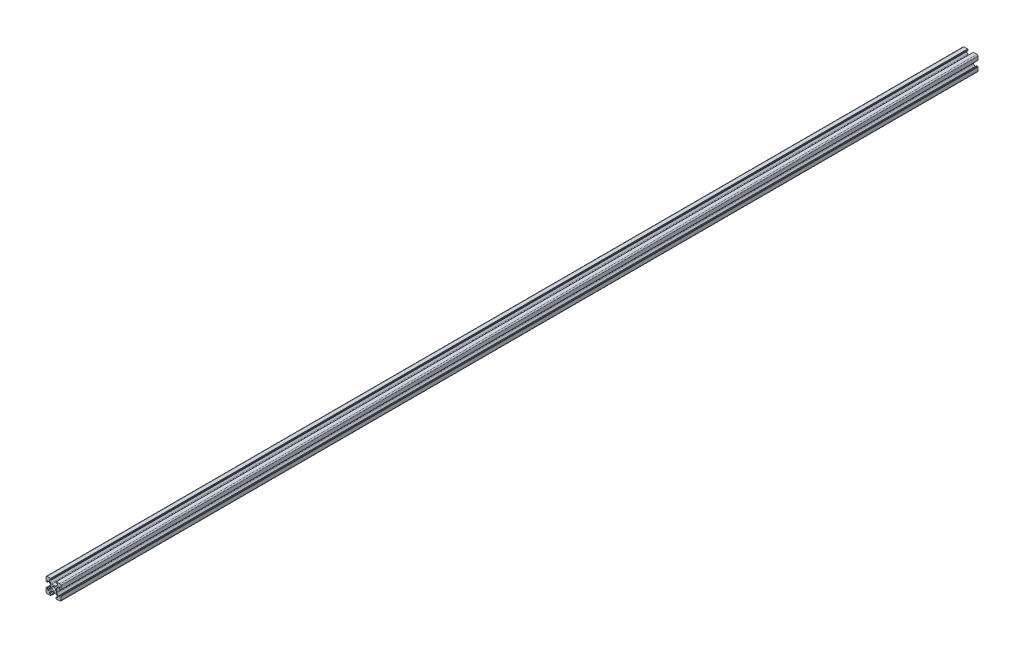
from build123d import *

# Parameters (mm, degrees)
SKETCH_1_R      = 2.5
EXTRUDE_1_DEPTH = 1220


with BuildPart() as part:
    # 草图1 → 凸台-拉伸1 (new body)
    with BuildSketch(Plane.XY):
        with BuildLine():
            ThreePointArc((-10.002261885, -8.502261885), (-9.562922057, -9.562922057), (-8.502261885, -10.002261885))
            Line((-8.502261885, -10.002261885), (-3.85, -10.002261885))
            ThreePointArc((-3.85, -10.002261885), (-3.673223305, -9.929038581), (-3.6, -9.752261885))
            Line((-3.6, -9.752261885), (-3.6, -9.502261885))
            Line((-3.6, -9.502261885), (-3.35, -9.502261885))
            ThreePointArc((-3.35, -9.502261885), (-3.173223305, -9.429038581), (-3.1, -9.252261885))
            Line((-3.1, -9.252261885), (-3.1, -8.45))
            ThreePointArc((-3.1, -8.45), (-3.173223305, -8.273223305), (-3.35, -8.2))
            Line((-3.35, -8.2), (-5.25, -8.2))
            ThreePointArc((-5.25, -8.2), (-5.426776695, -8.126776695), (-5.5, -7.95))
            Line((-5.5, -7.95), (-5.5, -6.664213562))
            ThreePointArc((-5.5, -6.664213562), (-5.480969883, -6.568542704), (-5.426776695, -6.487436867))
            Line((-5.426776695, -6.487436867), (-3.278679656, -4.339339828))
            ThreePointArc((-3.278679656, -4.339339828), (-2.792044633, -4.014180701), (-2.218019485, -3.9))
            Line((-2.218019485, -3.9), (2.218019485, -3.9))
            ThreePointArc((2.218019485, -3.9), (2.792044633, -4.014180701), (3.278679656, -4.339339828))
            Line((3.278679656, -4.339339828), (5.426776695, -6.487436867))
            ThreePointArc((5.426776695, -6.487436867), (5.480969883, -6.568542704), (5.5, -6.664213562))
            Line((5.5, -6.664213562), (5.5, -7.95))
            ThreePointArc((5.5, -7.95), (5.426776695, -8.126776695), (5.25, -8.2))
            Line((5.25, -8.2), (3.35, -8.2))
            ThreePointArc((3.35, -8.2), (3.173223305, -8.273223305), (3.1, -8.45))
            Line((3.1, -8.45), (3.1, -9.252261885))
            ThreePointArc((3.1, -9.252261885), (3.173223305, -9.429038581), (3.35, -9.502261885))
            Line((3.35, -9.502261885), (3.6, -9.502261885))
            Line((3.6, -9.502261885), (3.6, -9.752261885))
            ThreePointArc((3.6, -9.752261885), (3.673223305, -9.929038581), (3.85, -10.002261885))
            Line((3.85, -10.002261885), (8.502261885, -10.002261885))
            ThreePointArc((8.502261885, -10.002261885), (9.562922057, -9.562922057), (10.002261885, -8.502261885))
            Line((10.002261885, -8.502261885), (10.002261885, -3.85))
            ThreePointArc((10.002261885, -3.85), (9.929038581, -3.673223305), (9.752261885, -3.6))
            Line((9.752261885, -3.6), (9.502261885, -3.6))
            Line((9.502261885, -3.6), (9.502261885, -3.35))
            ThreePointArc((9.502261885, -3.35), (9.429038581, -3.173223305), (9.252261885, -3.1))
            Line((9.252261885, -3.1), (8.45, -3.1))
            ThreePointArc((8.45, -3.1), (8.273223305, -3.173223305), (8.2, -3.35))
            Line((8.2, -3.35), (8.2, -5.25))
            ThreePointArc((8.2, -5.25), (8.126776695, -5.426776695), (7.95, -5.5))
            Line((7.95, -5.5), (6.664213562, -5.5))
            ThreePointArc((6.664213562, -5.5), (6.568542704, -5.480969883), (6.487436867, -5.426776695))
            Line((6.487436867, -5.426776695), (4.339339828, -3.278679656))
            ThreePointArc((4.339339828, -3.278679656), (4.014180701, -2.792044633), (3.9, -2.218019485))
            Line((3.9, -2.218019485), (3.9, 2.218019485))
            ThreePointArc((3.9, 2.218019485), (4.014180701, 2.792044633), (4.339339828, 3.278679656))
            Line((4.339339828, 3.278679656), (6.487436867, 5.426776695))
            ThreePointArc((6.487436867, 5.426776695), (6.568542704, 5.480969883), (6.664213562, 5.5))
            Line((6.664213562, 5.5), (7.95, 5.5))
            ThreePointArc((7.95, 5.5), (8.126776695, 5.426776695), (8.2, 5.25))
            Line((8.2, 5.25), (8.2, 3.35))
            ThreePointArc((8.2, 3.35), (8.273223305, 3.173223305), (8.45, 3.1))
            Line((8.45, 3.1), (9.252261885, 3.1))
            ThreePointArc((9.252261885, 3.1), (9.429038581, 3.173223305), (9.502261885, 3.35))
            Line((9.502261885, 3.35), (9.502261885, 3.6))
            Line((9.502261885, 3.6), (9.752261885, 3.6))
            ThreePointArc((9.752261885, 3.6), (9.929038581, 3.673223305), (10.002261885, 3.85))
            Line((10.002261885, 3.85), (10.002261885, 8.502261885))
            ThreePointArc((10.002261885, 8.502261885), (9.562922057, 9.562922057), (8.502261885, 10.002261885))
            Line((8.502261885, 10.002261885), (3.85, 10.002261885))
            ThreePointArc((3.85, 10.002261885), (3.673223305, 9.929038581), (3.6, 9.752261885))
            Line((3.6, 9.752261885), (3.6, 9.502261885))
            Line((3.6, 9.502261885), (3.35, 9.502261885))
            ThreePointArc((3.35, 9.502261885), (3.173223305, 9.429038581), (3.1, 9.252261885))
            Line((3.1, 9.252261885), (3.1, 8.45))
            ThreePointArc((3.1, 8.45), (3.173223305, 8.273223305), (3.35, 8.2))
            Line((3.35, 8.2), (5.25, 8.2))
            ThreePointArc((5.25, 8.2), (5.426776695, 8.126776695), (5.5, 7.95))
            Line((5.5, 7.95), (5.5, 6.664213562))
            ThreePointArc((5.5, 6.664213562), (5.480969883, 6.568542704), (5.426776695, 6.487436867))
            Line((5.426776695, 6.487436867), (3.278679656, 4.339339828))
            ThreePointArc((3.278679656, 4.339339828), (2.792044633, 4.014180701), (2.218019485, 3.9))
            Line((2.218019485, 3.9), (-2.218019485, 3.9))
            ThreePointArc((-2.218019485, 3.9), (-2.792044633, 4.014180701), (-3.278679656, 4.339339828))
            Line((-3.278679656, 4.339339828), (-5.426776695, 6.487436867))
            ThreePointArc((-5.426776695, 6.487436867), (-5.480969883, 6.568542704), (-5.5, 6.664213562))
            Line((-5.5, 6.664213562), (-5.5, 7.95))
            ThreePointArc((-5.5, 7.95), (-5.426776695, 8.126776695), (-5.25, 8.2))
            Line((-5.25, 8.2), (-3.35, 8.2))
            ThreePointArc((-3.35, 8.2), (-3.173223305, 8.273223305), (-3.1, 8.45))
            Line((-3.1, 8.45), (-3.1, 9.252261885))
            ThreePointArc((-3.1, 9.252261885), (-3.173223305, 9.429038581), (-3.35, 9.502261885))
            Line((-3.35, 9.502261885), (-3.6, 9.502261885))
            Line((-3.6, 9.502261885), (-3.6, 9.752261885))
            ThreePointArc((-3.6, 9.752261885), (-3.673223305, 9.929038581), (-3.85, 10.002261885))
            Line((-3.85, 10.002261885), (-8.502261885, 10.002261885))
            ThreePointArc((-8.502261885, 10.002261885), (-9.562922057, 9.562922057), (-10.002261885, 8.502261885))
            Line((-10.002261885, 8.502261885), (-10.002261885, 3.85))
            ThreePointArc((-10.002261885, 3.85), (-9.929038581, 3.673223305), (-9.752261885, 3.6))
            Line((-9.752261885, 3.6), (-9.502261885, 3.6))
            Line((-9.502261885, 3.6), (-9.502261885, 3.35))
            ThreePointArc((-9.502261885, 3.35), (-9.429038581, 3.173223305), (-9.252261885, 3.1))
            Line((-9.252261885, 3.1), (-8.45, 3.1))
            ThreePointArc((-8.45, 3.1), (-8.273223305, 3.173223305), (-8.2, 3.35))
            Line((-8.2, 3.35), (-8.2, 5.25))
            ThreePointArc((-8.2, 5.25), (-8.126776695, 5.426776695), (-7.95, 5.5))
            Line((-7.95, 5.5), (-6.664213562, 5.5))
            ThreePointArc((-6.664213562, 5.5), (-6.568542704, 5.480969883), (-6.487436867, 5.426776695))
            Line((-6.487436867, 5.426776695), (-4.339339828, 3.278679656))
            ThreePointArc((-4.339339828, 3.278679656), (-4.014180701, 2.792044633), (-3.9, 2.218019485))
            Line((-3.9, 2.218019485), (-3.9, -2.218019485))
            ThreePointArc((-3.9, -2.218019485), (-4.014180701, -2.792044633), (-4.339339828, -3.278679656))
            Line((-4.339339828, -3.278679656), (-6.487436867, -5.426776695))
            ThreePointArc((-6.487436867, -5.426776695), (-6.568542704, -5.480969883), (-6.664213562, -5.5))
            Line((-6.664213562, -5.5), (-7.95, -5.5))
            ThreePointArc((-7.95, -5.5), (-8.126776695, -5.426776695), (-8.2, -5.25))
            Line((-8.2, -5.25), (-8.2, -3.35))
            ThreePointArc((-8.2, -3.35), (-8.273223305, -3.173223305), (-8.45, -3.1))
            Line((-8.45, -3.1), (-9.252261885, -3.1))
            ThreePointArc((-9.252261885, -3.1), (-9.429038581, -3.173223305), (-9.502261885, -3.35))
            Line((-9.502261885, -3.35), (-9.502261885, -3.6))
            Line((-9.502261885, -3.6), (-9.752261885, -3.6))
            ThreePointArc((-9.752261885, -3.6), (-9.929038581, -3.673223305), (-10.002261885, -3.85))
            Line((-10.002261885, -3.85), (-10.002261885, -8.502261885))
        make_face()
        Circle(SKETCH_1_R, mode=Mode.SUBTRACT)
    extrude(amount=EXTRUDE_1_DEPTH)


solid = part.part
